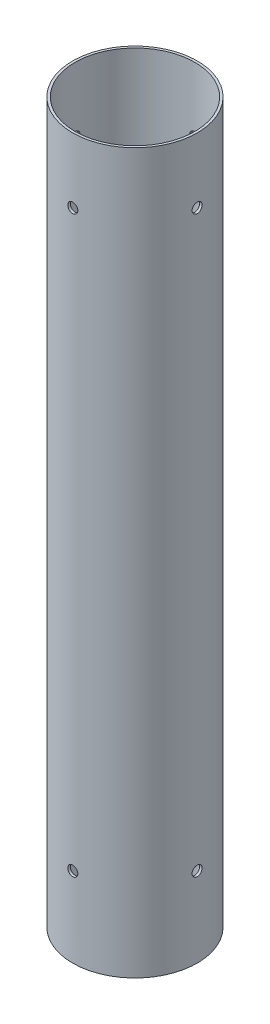
from build123d import *

# Parameters (mm, degrees)
SKETCH1_R           = 39.624
SKETCH1_R_2         = 38.1
BOSS_EXTRUDE1_DEPTH = 457.2
SKETCH2_R           = 3.175
CUT_EXTRUDE1_DEPTH  = 461.621279092
CIRPATTERN1_COUNT   = 4
SKETCH4_R           = 3.175
CUT_EXTRUDE2_DEPTH  = 461.621279208
CIRPATTERN2_COUNT   = 4


with BuildPart() as part:
    # Sketch1 → Boss-Extrude1 (new body)
    with BuildSketch(Plane(origin=(0, 0, 0), x_dir=(1, 0, 0), z_dir=(0, 1, 0))):
        Circle(SKETCH1_R)
        Circle(SKETCH1_R_2, mode=Mode.SUBTRACT)
    extrude(amount=BOSS_EXTRUDE1_DEPTH)

    # Sketch2 → Cut-Extrude1 (cut, through all)
    with BuildSketch(Plane.XY):
        with Locations((0, 415.925)):
            Circle(SKETCH2_R)
    cut_extrude1 = extrude(amount=CUT_EXTRUDE1_DEPTH, mode=Mode.SUBTRACT)

    # CirPattern1: Cut-Extrude1 ×4 about axis
    cirpattern1_axis = Axis((0, 457.2, 0), (0, -1, 0))
    for i in range(1, CIRPATTERN1_COUNT):
        add(cut_extrude1.rotate(cirpattern1_axis, i * 360 / CIRPATTERN1_COUNT), mode=Mode.SUBTRACT)

    # Sketch4 → Cut-Extrude2 (cut, through all)
    with BuildSketch(Plane.XY):
        with Locations((0, 50.8)):
            Circle(SKETCH4_R)
    cut_extrude2 = extrude(amount=CUT_EXTRUDE2_DEPTH, mode=Mode.SUBTRACT)

    # CirPattern2: Cut-Extrude2 ×4 about axis
    cirpattern2_axis = Axis((0, 457.2, 0), (0, -1, 0))
    for i in range(1, CIRPATTERN2_COUNT):
        add(cut_extrude2.rotate(cirpattern2_axis, i * 360 / CIRPATTERN2_COUNT), mode=Mode.SUBTRACT)


solid = part.part
